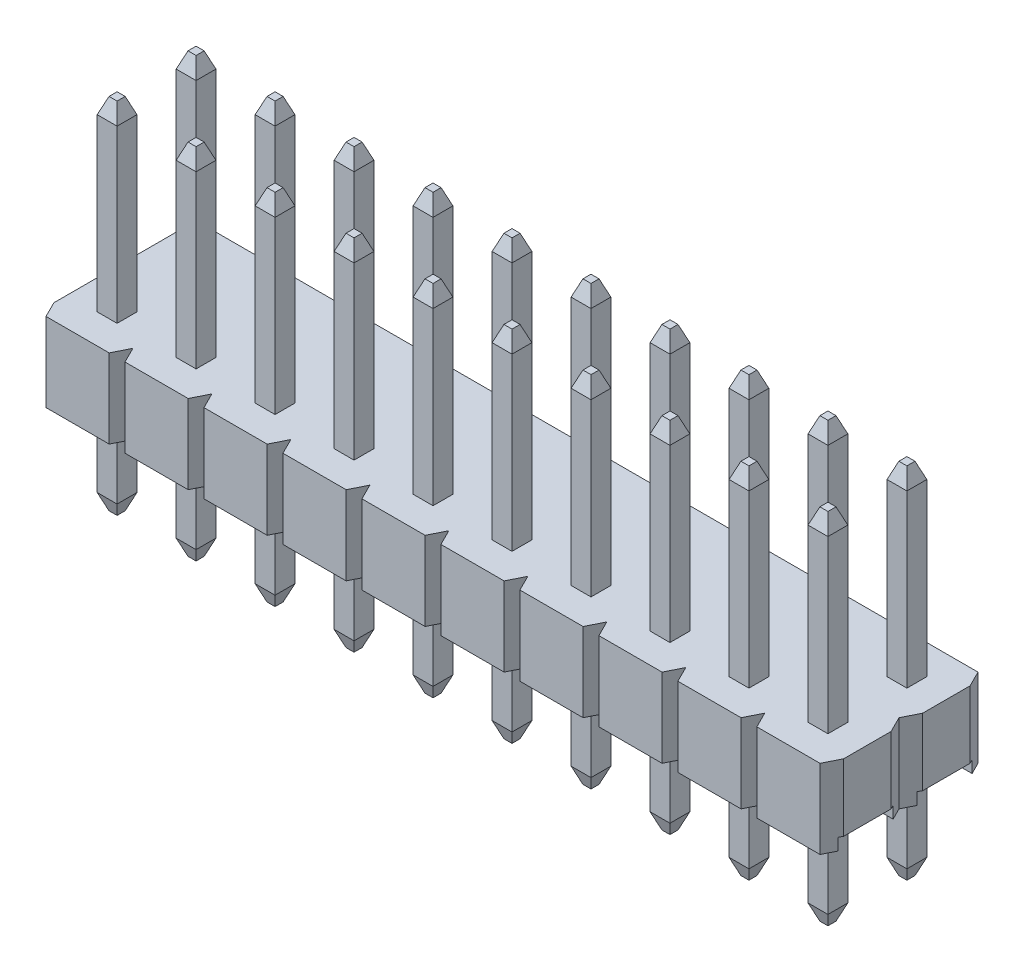
from build123d import *
from OCP.BRepFilletAPI import BRepFilletAPI_MakeChamfer

# Parameters (mm, degrees)
SKETCH1_W                     = 2.54
SKETCH1_H                     = 2.54
MAIN_BODY_DEPTH               = 2.54
SKETCH3_W                     = 1.778
SKETCH3_H                     = 0.381
CUT_EXTRUDE1_DEPTH            = 5.399409051
CUT_EXTRUDE2_DEPTH            = 5.399409051
BODY_PATTERN_COUNT            = 10
BODY_PATTERN_PITCH            = 2.54
PIN_START                     = -5.54
SKETCH2_W                     = 0.64
SKETCH2_H                     = 0.64
PIN_DEPTH                     = 11.54
CHAMFER1_SIZE                 = 0.508
CHAMFER1_SIZE2                = 0.1905
CHAMFER2_SIZE                 = 0.1905
CHAMFER2_SIZE2                = 0.508
PIN_PATTERN_COUNT             = 10
PIN_PATTERN_PITCH             = 2.54
CHAMFER1_OF_PIN_PATTERN_SIZE  = 0.508
CHAMFER1_OF_PIN_PATTERN_SIZE2 = 0.1905
CHAMFER2_OF_PIN_PATTERN_SIZE2 = 0.1905
CHAMFER2_OF_PIN_PATTERN_SIZE  = 0.508
ROW_START                     = 0.381
ROW_PATTERN_DEPTH             = 2.159
ROW_START_2                   = -2.492
ROW_PATTERN_2_OUTLINE_W       = 0.64
ROW_PATTERN_2_OUTLINE_H       = 0.64
ROW_PATTERN_2_DEPTH           = 10.524
ROW_PATTERN_3_DEPTH           = 0.381


with BuildPart() as part:
    # Sketch1 → Main Body (new body)
    with BuildSketch(Plane(origin=(0, 0, 0), x_dir=(1, 0, 0), z_dir=(0, 1, 0))):
        with Locations((1.27, 1.27)):
            Rectangle(SKETCH1_W, SKETCH1_H)
    main_body = extrude(amount=MAIN_BODY_DEPTH)

    # Sketch3 → Cut-Extrude1 (cut, through all)
    with BuildSketch(Plane.ZY):
        with Locations((-1.27, 0.1905)):
            Rectangle(SKETCH3_W, SKETCH3_H)
    cut_extrude1 = extrude(amount=-CUT_EXTRUDE1_DEPTH, mode=Mode.SUBTRACT)

    # Sketch4 → Cut-Extrude2 (cut, through all)
    with BuildSketch(Plane(origin=(0, 2.54, 0), x_dir=(1, 0, 0), z_dir=(0, 1, 0))):
        Polygon((0.254, 2.54), (0, 2.54), (0, 2.032), align=None)
        Polygon((2.54, 2.54), (2.286, 2.54), (2.54, 2.032), align=None)
        Polygon((0.254, 0), (0, 0.508), (0, 0), align=None)
        Polygon((2.54, 0), (2.286, 0), (2.54, 0.508), align=None)
    cut_extrude2 = extrude(amount=-CUT_EXTRUDE2_DEPTH, mode=Mode.SUBTRACT)

    # Body Pattern: Main Body, Cut-Extrude1, Cut-Extrude2 ×10
    with Locations(*[(-i * BODY_PATTERN_PITCH, 0, 0) for i in range(1, BODY_PATTERN_COUNT)]):
        add(main_body)
        add(cut_extrude1, mode=Mode.SUBTRACT)
        add(cut_extrude2, mode=Mode.SUBTRACT)

    # Sketch2 → Pin (add)
    with BuildSketch(Plane(origin=(0, 2.54, 0), x_dir=(1, 0, 0), z_dir=(0, 1, 0)).offset(PIN_START)):
        with Locations((1.27, 1.27)):
            Rectangle(SKETCH2_W, SKETCH2_H)
    pin = extrude(amount=PIN_DEPTH)

    # Chamfer1: one chamfer whose edges measure the first distance from different faces: ONE call of the kernel's chamfer builder (chamfer() names one face for all edges)
    chamfer1_edges_1 = [part.edges().sort_by_distance(p)[0] for p in [
        (0.95, 8.54, -1.27),
    ]]
    chamfer1_side_1 = [part.faces().sort_by_distance(p)[0] for p in [
        (0.95, 5.54, -1.27),
    ]]
    chamfer1_edges_2 = [part.edges().sort_by_distance(p)[0] for p in [
        (1.27, 8.54, -0.95),
    ]]
    chamfer1_side_2 = [part.faces().sort_by_distance(p)[0] for p in [
        (1.27, 5.54, -0.95),
    ]]
    chamfer1_edges_3 = [part.edges().sort_by_distance(p)[0] for p in [
        (1.59, 8.54, -1.27),
    ]]
    chamfer1_side_3 = [part.faces().sort_by_distance(p)[0] for p in [
        (1.59, 5.54, -1.27),
    ]]
    chamfer1_edges_4 = [part.edges().sort_by_distance(p)[0] for p in [
        (1.27, 8.54, -1.59),
    ]]
    chamfer1_side_4 = [part.faces().sort_by_distance(p)[0] for p in [
        (1.27, 5.54, -1.59),
    ]]
    chamfer1 = BRepFilletAPI_MakeChamfer(part.part.solid().wrapped)
    for e in chamfer1_edges_1:
        chamfer1.Add(CHAMFER1_SIZE, CHAMFER1_SIZE2, e.wrapped, chamfer1_side_1[0].wrapped)  # the first distance lies on this face
    for e in chamfer1_edges_2:
        chamfer1.Add(CHAMFER1_SIZE, CHAMFER1_SIZE2, e.wrapped, chamfer1_side_2[0].wrapped)  # the first distance lies on this face
    for e in chamfer1_edges_3:
        chamfer1.Add(CHAMFER1_SIZE, CHAMFER1_SIZE2, e.wrapped, chamfer1_side_3[0].wrapped)  # the first distance lies on this face
    for e in chamfer1_edges_4:
        chamfer1.Add(CHAMFER1_SIZE, CHAMFER1_SIZE2, e.wrapped, chamfer1_side_4[0].wrapped)  # the first distance lies on this face
    add(Compound.cast(chamfer1.Shape()), mode=Mode.REPLACE)

    # Chamfer2
    chamfer2_edges = [part.edges().sort_by_distance(p)[0] for p in [
        (1.27, -3, -0.95),
        (1.59, -3, -1.27),
        (1.27, -3, -1.59),
        (0.95, -3, -1.27),
    ]]
    chamfer2_side = [part.faces().sort_by_distance(p)[0] for p in [
        (1.27, -3, -1.27),
    ]]
    chamfer(chamfer2_edges, length=CHAMFER2_SIZE, length2=CHAMFER2_SIZE2, reference=chamfer2_side[0])

    # Pin Pattern: Pin ×10
    with Locations(*[(-i * PIN_PATTERN_PITCH, 0, 0) for i in range(1, PIN_PATTERN_COUNT)]):
        add(pin)

    # Chamfer1 of Pin Pattern: one chamfer whose edges measure the first distance from different faces: ONE call of the kernel's chamfer builder (chamfer() names one face for all edges)
    chamfer1_of_pin_pattern_edges_1 = [part.edges().sort_by_distance(p)[0] for p in [
        (-1.59, 8.54, -1.27),
    ]]
    chamfer1_of_pin_pattern_side_1 = [part.faces().sort_by_distance(p)[0] for p in [
        (-1.59, 5.54, -1.27),
    ]]
    chamfer1_of_pin_pattern_edges_2 = [part.edges().sort_by_distance(p)[0] for p in [
        (-1.27, 8.54, -0.95),
    ]]
    chamfer1_of_pin_pattern_side_2 = [part.faces().sort_by_distance(p)[0] for p in [
        (-1.27, 5.54, -0.95),
    ]]
    chamfer1_of_pin_pattern_edges_3 = [part.edges().sort_by_distance(p)[0] for p in [
        (-0.95, 8.54, -1.27),
    ]]
    chamfer1_of_pin_pattern_side_3 = [part.faces().sort_by_distance(p)[0] for p in [
        (-0.95, 5.54, -1.27),
    ]]
    chamfer1_of_pin_pattern_edges_4 = [part.edges().sort_by_distance(p)[0] for p in [
        (-1.27, 8.54, -1.59),
    ]]
    chamfer1_of_pin_pattern_side_4 = [part.faces().sort_by_distance(p)[0] for p in [
        (-1.27, 5.54, -1.59),
    ]]
    chamfer1_of_pin_pattern_edges_5 = [part.edges().sort_by_distance(p)[0] for p in [
        (-4.13, 8.54, -1.27),
    ]]
    chamfer1_of_pin_pattern_side_5 = [part.faces().sort_by_distance(p)[0] for p in [
        (-4.13, 5.54, -1.27),
    ]]
    chamfer1_of_pin_pattern_edges_6 = [part.edges().sort_by_distance(p)[0] for p in [
        (-3.81, 8.54, -0.95),
    ]]
    chamfer1_of_pin_pattern_side_6 = [part.faces().sort_by_distance(p)[0] for p in [
        (-3.81, 5.54, -0.95),
    ]]
    chamfer1_of_pin_pattern_edges_7 = [part.edges().sort_by_distance(p)[0] for p in [
        (-3.49, 8.54, -1.27),
    ]]
    chamfer1_of_pin_pattern_side_7 = [part.faces().sort_by_distance(p)[0] for p in [
        (-3.49, 5.54, -1.27),
    ]]
    chamfer1_of_pin_pattern_edges_8 = [part.edges().sort_by_distance(p)[0] for p in [
        (-3.81, 8.54, -1.59),
    ]]
    chamfer1_of_pin_pattern_side_8 = [part.faces().sort_by_distance(p)[0] for p in [
        (-3.81, 5.54, -1.59),
    ]]
    chamfer1_of_pin_pattern_edges_9 = [part.edges().sort_by_distance(p)[0] for p in [
        (-6.67, 8.54, -1.27),
    ]]
    chamfer1_of_pin_pattern_side_9 = [part.faces().sort_by_distance(p)[0] for p in [
        (-6.67, 5.54, -1.27),
    ]]
    chamfer1_of_pin_pattern_edges_10 = [part.edges().sort_by_distance(p)[0] for p in [
        (-6.35, 8.54, -0.95),
    ]]
    chamfer1_of_pin_pattern_side_10 = [part.faces().sort_by_distance(p)[0] for p in [
        (-6.35, 5.54, -0.95),
    ]]
    chamfer1_of_pin_pattern_edges_11 = [part.edges().sort_by_distance(p)[0] for p in [
        (-6.03, 8.54, -1.27),
    ]]
    chamfer1_of_pin_pattern_side_11 = [part.faces().sort_by_distance(p)[0] for p in [
        (-6.03, 5.54, -1.27),
    ]]
    chamfer1_of_pin_pattern_edges_12 = [part.edges().sort_by_distance(p)[0] for p in [
        (-6.35, 8.54, -1.59),
    ]]
    chamfer1_of_pin_pattern_side_12 = [part.faces().sort_by_distance(p)[0] for p in [
        (-6.35, 5.54, -1.59),
    ]]
    chamfer1_of_pin_pattern_edges_13 = [part.edges().sort_by_distance(p)[0] for p in [
        (-9.21, 8.54, -1.27),
    ]]
    chamfer1_of_pin_pattern_side_13 = [part.faces().sort_by_distance(p)[0] for p in [
        (-9.21, 5.54, -1.27),
    ]]
    chamfer1_of_pin_pattern_edges_14 = [part.edges().sort_by_distance(p)[0] for p in [
        (-8.89, 8.54, -0.95),
    ]]
    chamfer1_of_pin_pattern_side_14 = [part.faces().sort_by_distance(p)[0] for p in [
        (-8.89, 5.54, -0.95),
    ]]
    chamfer1_of_pin_pattern_edges_15 = [part.edges().sort_by_distance(p)[0] for p in [
        (-8.57, 8.54, -1.27),
    ]]
    chamfer1_of_pin_pattern_side_15 = [part.faces().sort_by_distance(p)[0] for p in [
        (-8.57, 5.54, -1.27),
    ]]
    chamfer1_of_pin_pattern_edges_16 = [part.edges().sort_by_distance(p)[0] for p in [
        (-8.89, 8.54, -1.59),
    ]]
    chamfer1_of_pin_pattern_side_16 = [part.faces().sort_by_distance(p)[0] for p in [
        (-8.89, 5.54, -1.59),
    ]]
    chamfer1_of_pin_pattern_edges_17 = [part.edges().sort_by_distance(p)[0] for p in [
        (-11.75, 8.54, -1.27),
    ]]
    chamfer1_of_pin_pattern_side_17 = [part.faces().sort_by_distance(p)[0] for p in [
        (-11.75, 5.54, -1.27),
    ]]
    chamfer1_of_pin_pattern_edges_18 = [part.edges().sort_by_distance(p)[0] for p in [
        (-11.43, 8.54, -0.95),
    ]]
    chamfer1_of_pin_pattern_side_18 = [part.faces().sort_by_distance(p)[0] for p in [
        (-11.43, 5.54, -0.95),
    ]]
    chamfer1_of_pin_pattern_edges_19 = [part.edges().sort_by_distance(p)[0] for p in [
        (-11.11, 8.54, -1.27),
    ]]
    chamfer1_of_pin_pattern_side_19 = [part.faces().sort_by_distance(p)[0] for p in [
        (-11.11, 5.54, -1.27),
    ]]
    chamfer1_of_pin_pattern_edges_20 = [part.edges().sort_by_distance(p)[0] for p in [
        (-11.43, 8.54, -1.59),
    ]]
    chamfer1_of_pin_pattern_side_20 = [part.faces().sort_by_distance(p)[0] for p in [
        (-11.43, 5.54, -1.59),
    ]]
    chamfer1_of_pin_pattern_edges_21 = [part.edges().sort_by_distance(p)[0] for p in [
        (-14.29, 8.54, -1.27),
    ]]
    chamfer1_of_pin_pattern_side_21 = [part.faces().sort_by_distance(p)[0] for p in [
        (-14.29, 5.54, -1.27),
    ]]
    chamfer1_of_pin_pattern_edges_22 = [part.edges().sort_by_distance(p)[0] for p in [
        (-13.97, 8.54, -0.95),
    ]]
    chamfer1_of_pin_pattern_side_22 = [part.faces().sort_by_distance(p)[0] for p in [
        (-13.97, 5.54, -0.95),
    ]]
    chamfer1_of_pin_pattern_edges_23 = [part.edges().sort_by_distance(p)[0] for p in [
        (-13.65, 8.54, -1.27),
    ]]
    chamfer1_of_pin_pattern_side_23 = [part.faces().sort_by_distance(p)[0] for p in [
        (-13.65, 5.54, -1.27),
    ]]
    chamfer1_of_pin_pattern_edges_24 = [part.edges().sort_by_distance(p)[0] for p in [
        (-13.97, 8.54, -1.59),
    ]]
    chamfer1_of_pin_pattern_side_24 = [part.faces().sort_by_distance(p)[0] for p in [
        (-13.97, 5.54, -1.59),
    ]]
    chamfer1_of_pin_pattern_edges_25 = [part.edges().sort_by_distance(p)[0] for p in [
        (-16.83, 8.54, -1.27),
    ]]
    chamfer1_of_pin_pattern_side_25 = [part.faces().sort_by_distance(p)[0] for p in [
        (-16.83, 5.54, -1.27),
    ]]
    chamfer1_of_pin_pattern_edges_26 = [part.edges().sort_by_distance(p)[0] for p in [
        (-16.51, 8.54, -0.95),
    ]]
    chamfer1_of_pin_pattern_side_26 = [part.faces().sort_by_distance(p)[0] for p in [
        (-16.51, 5.54, -0.95),
    ]]
    chamfer1_of_pin_pattern_edges_27 = [part.edges().sort_by_distance(p)[0] for p in [
        (-16.19, 8.54, -1.27),
    ]]
    chamfer1_of_pin_pattern_side_27 = [part.faces().sort_by_distance(p)[0] for p in [
        (-16.19, 5.54, -1.27),
    ]]
    chamfer1_of_pin_pattern_edges_28 = [part.edges().sort_by_distance(p)[0] for p in [
        (-16.51, 8.54, -1.59),
    ]]
    chamfer1_of_pin_pattern_side_28 = [part.faces().sort_by_distance(p)[0] for p in [
        (-16.51, 5.54, -1.59),
    ]]
    chamfer1_of_pin_pattern_edges_29 = [part.edges().sort_by_distance(p)[0] for p in [
        (-19.37, 8.54, -1.27),
    ]]
    chamfer1_of_pin_pattern_side_29 = [part.faces().sort_by_distance(p)[0] for p in [
        (-19.37, 5.54, -1.27),
    ]]
    chamfer1_of_pin_pattern_edges_30 = [part.edges().sort_by_distance(p)[0] for p in [
        (-19.05, 8.54, -0.95),
    ]]
    chamfer1_of_pin_pattern_side_30 = [part.faces().sort_by_distance(p)[0] for p in [
        (-19.05, 5.54, -0.95),
    ]]
    chamfer1_of_pin_pattern_edges_31 = [part.edges().sort_by_distance(p)[0] for p in [
        (-18.73, 8.54, -1.27),
    ]]
    chamfer1_of_pin_pattern_side_31 = [part.faces().sort_by_distance(p)[0] for p in [
        (-18.73, 5.54, -1.27),
    ]]
    chamfer1_of_pin_pattern_edges_32 = [part.edges().sort_by_distance(p)[0] for p in [
        (-19.05, 8.54, -1.59),
    ]]
    chamfer1_of_pin_pattern_side_32 = [part.faces().sort_by_distance(p)[0] for p in [
        (-19.05, 5.54, -1.59),
    ]]
    chamfer1_of_pin_pattern_edges_33 = [part.edges().sort_by_distance(p)[0] for p in [
        (-21.91, 8.54, -1.27),
    ]]
    chamfer1_of_pin_pattern_side_33 = [part.faces().sort_by_distance(p)[0] for p in [
        (-21.91, 5.54, -1.27),
    ]]
    chamfer1_of_pin_pattern_edges_34 = [part.edges().sort_by_distance(p)[0] for p in [
        (-21.59, 8.54, -0.95),
    ]]
    chamfer1_of_pin_pattern_side_34 = [part.faces().sort_by_distance(p)[0] for p in [
        (-21.59, 5.54, -0.95),
    ]]
    chamfer1_of_pin_pattern_edges_35 = [part.edges().sort_by_distance(p)[0] for p in [
        (-21.27, 8.54, -1.27),
    ]]
    chamfer1_of_pin_pattern_side_35 = [part.faces().sort_by_distance(p)[0] for p in [
        (-21.27, 5.54, -1.27),
    ]]
    chamfer1_of_pin_pattern_edges_36 = [part.edges().sort_by_distance(p)[0] for p in [
        (-21.59, 8.54, -1.59),
    ]]
    chamfer1_of_pin_pattern_side_36 = [part.faces().sort_by_distance(p)[0] for p in [
        (-21.59, 5.54, -1.59),
    ]]
    chamfer1_of_pin_pattern = BRepFilletAPI_MakeChamfer(part.part.solid().wrapped)
    for e in chamfer1_of_pin_pattern_edges_1:
        chamfer1_of_pin_pattern.Add(CHAMFER1_OF_PIN_PATTERN_SIZE, CHAMFER1_OF_PIN_PATTERN_SIZE2, e.wrapped, chamfer1_of_pin_pattern_side_1[0].wrapped)  # the first distance lies on this face
    for e in chamfer1_of_pin_pattern_edges_2:
        chamfer1_of_pin_pattern.Add(CHAMFER1_OF_PIN_PATTERN_SIZE, CHAMFER1_OF_PIN_PATTERN_SIZE2, e.wrapped, chamfer1_of_pin_pattern_side_2[0].wrapped)  # the first distance lies on this face
    for e in chamfer1_of_pin_pattern_edges_3:
        chamfer1_of_pin_pattern.Add(CHAMFER1_OF_PIN_PATTERN_SIZE, CHAMFER1_OF_PIN_PATTERN_SIZE2, e.wrapped, chamfer1_of_pin_pattern_side_3[0].wrapped)  # the first distance lies on this face
    for e in chamfer1_of_pin_pattern_edges_4:
        chamfer1_of_pin_pattern.Add(CHAMFER1_OF_PIN_PATTERN_SIZE, CHAMFER1_OF_PIN_PATTERN_SIZE2, e.wrapped, chamfer1_of_pin_pattern_side_4[0].wrapped)  # the first distance lies on this face
    for e in chamfer1_of_pin_pattern_edges_5:
        chamfer1_of_pin_pattern.Add(CHAMFER1_OF_PIN_PATTERN_SIZE, CHAMFER1_OF_PIN_PATTERN_SIZE2, e.wrapped, chamfer1_of_pin_pattern_side_5[0].wrapped)  # the first distance lies on this face
    for e in chamfer1_of_pin_pattern_edges_6:
        chamfer1_of_pin_pattern.Add(CHAMFER1_OF_PIN_PATTERN_SIZE, CHAMFER1_OF_PIN_PATTERN_SIZE2, e.wrapped, chamfer1_of_pin_pattern_side_6[0].wrapped)  # the first distance lies on this face
    for e in chamfer1_of_pin_pattern_edges_7:
        chamfer1_of_pin_pattern.Add(CHAMFER1_OF_PIN_PATTERN_SIZE, CHAMFER1_OF_PIN_PATTERN_SIZE2, e.wrapped, chamfer1_of_pin_pattern_side_7[0].wrapped)  # the first distance lies on this face
    for e in chamfer1_of_pin_pattern_edges_8:
        chamfer1_of_pin_pattern.Add(CHAMFER1_OF_PIN_PATTERN_SIZE, CHAMFER1_OF_PIN_PATTERN_SIZE2, e.wrapped, chamfer1_of_pin_pattern_side_8[0].wrapped)  # the first distance lies on this face
    for e in chamfer1_of_pin_pattern_edges_9:
        chamfer1_of_pin_pattern.Add(CHAMFER1_OF_PIN_PATTERN_SIZE, CHAMFER1_OF_PIN_PATTERN_SIZE2, e.wrapped, chamfer1_of_pin_pattern_side_9[0].wrapped)  # the first distance lies on this face
    for e in chamfer1_of_pin_pattern_edges_10:
        chamfer1_of_pin_pattern.Add(CHAMFER1_OF_PIN_PATTERN_SIZE, CHAMFER1_OF_PIN_PATTERN_SIZE2, e.wrapped, chamfer1_of_pin_pattern_side_10[0].wrapped)  # the first distance lies on this face
    for e in chamfer1_of_pin_pattern_edges_11:
        chamfer1_of_pin_pattern.Add(CHAMFER1_OF_PIN_PATTERN_SIZE, CHAMFER1_OF_PIN_PATTERN_SIZE2, e.wrapped, chamfer1_of_pin_pattern_side_11[0].wrapped)  # the first distance lies on this face
    for e in chamfer1_of_pin_pattern_edges_12:
        chamfer1_of_pin_pattern.Add(CHAMFER1_OF_PIN_PATTERN_SIZE, CHAMFER1_OF_PIN_PATTERN_SIZE2, e.wrapped, chamfer1_of_pin_pattern_side_12[0].wrapped)  # the first distance lies on this face
    for e in chamfer1_of_pin_pattern_edges_13:
        chamfer1_of_pin_pattern.Add(CHAMFER1_OF_PIN_PATTERN_SIZE, CHAMFER1_OF_PIN_PATTERN_SIZE2, e.wrapped, chamfer1_of_pin_pattern_side_13[0].wrapped)  # the first distance lies on this face
    for e in chamfer1_of_pin_pattern_edges_14:
        chamfer1_of_pin_pattern.Add(CHAMFER1_OF_PIN_PATTERN_SIZE, CHAMFER1_OF_PIN_PATTERN_SIZE2, e.wrapped, chamfer1_of_pin_pattern_side_14[0].wrapped)  # the first distance lies on this face
    for e in chamfer1_of_pin_pattern_edges_15:
        chamfer1_of_pin_pattern.Add(CHAMFER1_OF_PIN_PATTERN_SIZE, CHAMFER1_OF_PIN_PATTERN_SIZE2, e.wrapped, chamfer1_of_pin_pattern_side_15[0].wrapped)  # the first distance lies on this face
    for e in chamfer1_of_pin_pattern_edges_16:
        chamfer1_of_pin_pattern.Add(CHAMFER1_OF_PIN_PATTERN_SIZE, CHAMFER1_OF_PIN_PATTERN_SIZE2, e.wrapped, chamfer1_of_pin_pattern_side_16[0].wrapped)  # the first distance lies on this face
    for e in chamfer1_of_pin_pattern_edges_17:
        chamfer1_of_pin_pattern.Add(CHAMFER1_OF_PIN_PATTERN_SIZE, CHAMFER1_OF_PIN_PATTERN_SIZE2, e.wrapped, chamfer1_of_pin_pattern_side_17[0].wrapped)  # the first distance lies on this face
    for e in chamfer1_of_pin_pattern_edges_18:
        chamfer1_of_pin_pattern.Add(CHAMFER1_OF_PIN_PATTERN_SIZE, CHAMFER1_OF_PIN_PATTERN_SIZE2, e.wrapped, chamfer1_of_pin_pattern_side_18[0].wrapped)  # the first distance lies on this face
    for e in chamfer1_of_pin_pattern_edges_19:
        chamfer1_of_pin_pattern.Add(CHAMFER1_OF_PIN_PATTERN_SIZE, CHAMFER1_OF_PIN_PATTERN_SIZE2, e.wrapped, chamfer1_of_pin_pattern_side_19[0].wrapped)  # the first distance lies on this face
    for e in chamfer1_of_pin_pattern_edges_20:
        chamfer1_of_pin_pattern.Add(CHAMFER1_OF_PIN_PATTERN_SIZE, CHAMFER1_OF_PIN_PATTERN_SIZE2, e.wrapped, chamfer1_of_pin_pattern_side_20[0].wrapped)  # the first distance lies on this face
    for e in chamfer1_of_pin_pattern_edges_21:
        chamfer1_of_pin_pattern.Add(CHAMFER1_OF_PIN_PATTERN_SIZE, CHAMFER1_OF_PIN_PATTERN_SIZE2, e.wrapped, chamfer1_of_pin_pattern_side_21[0].wrapped)  # the first distance lies on this face
    for e in chamfer1_of_pin_pattern_edges_22:
        chamfer1_of_pin_pattern.Add(CHAMFER1_OF_PIN_PATTERN_SIZE, CHAMFER1_OF_PIN_PATTERN_SIZE2, e.wrapped, chamfer1_of_pin_pattern_side_22[0].wrapped)  # the first distance lies on this face
    for e in chamfer1_of_pin_pattern_edges_23:
        chamfer1_of_pin_pattern.Add(CHAMFER1_OF_PIN_PATTERN_SIZE, CHAMFER1_OF_PIN_PATTERN_SIZE2, e.wrapped, chamfer1_of_pin_pattern_side_23[0].wrapped)  # the first distance lies on this face
    for e in chamfer1_of_pin_pattern_edges_24:
        chamfer1_of_pin_pattern.Add(CHAMFER1_OF_PIN_PATTERN_SIZE, CHAMFER1_OF_PIN_PATTERN_SIZE2, e.wrapped, chamfer1_of_pin_pattern_side_24[0].wrapped)  # the first distance lies on this face
    for e in chamfer1_of_pin_pattern_edges_25:
        chamfer1_of_pin_pattern.Add(CHAMFER1_OF_PIN_PATTERN_SIZE, CHAMFER1_OF_PIN_PATTERN_SIZE2, e.wrapped, chamfer1_of_pin_pattern_side_25[0].wrapped)  # the first distance lies on this face
    for e in chamfer1_of_pin_pattern_edges_26:
        chamfer1_of_pin_pattern.Add(CHAMFER1_OF_PIN_PATTERN_SIZE, CHAMFER1_OF_PIN_PATTERN_SIZE2, e.wrapped, chamfer1_of_pin_pattern_side_26[0].wrapped)  # the first distance lies on this face
    for e in chamfer1_of_pin_pattern_edges_27:
        chamfer1_of_pin_pattern.Add(CHAMFER1_OF_PIN_PATTERN_SIZE, CHAMFER1_OF_PIN_PATTERN_SIZE2, e.wrapped, chamfer1_of_pin_pattern_side_27[0].wrapped)  # the first distance lies on this face
    for e in chamfer1_of_pin_pattern_edges_28:
        chamfer1_of_pin_pattern.Add(CHAMFER1_OF_PIN_PATTERN_SIZE, CHAMFER1_OF_PIN_PATTERN_SIZE2, e.wrapped, chamfer1_of_pin_pattern_side_28[0].wrapped)  # the first distance lies on this face
    for e in chamfer1_of_pin_pattern_edges_29:
        chamfer1_of_pin_pattern.Add(CHAMFER1_OF_PIN_PATTERN_SIZE, CHAMFER1_OF_PIN_PATTERN_SIZE2, e.wrapped, chamfer1_of_pin_pattern_side_29[0].wrapped)  # the first distance lies on this face
    for e in chamfer1_of_pin_pattern_edges_30:
        chamfer1_of_pin_pattern.Add(CHAMFER1_OF_PIN_PATTERN_SIZE, CHAMFER1_OF_PIN_PATTERN_SIZE2, e.wrapped, chamfer1_of_pin_pattern_side_30[0].wrapped)  # the first distance lies on this face
    for e in chamfer1_of_pin_pattern_edges_31:
        chamfer1_of_pin_pattern.Add(CHAMFER1_OF_PIN_PATTERN_SIZE, CHAMFER1_OF_PIN_PATTERN_SIZE2, e.wrapped, chamfer1_of_pin_pattern_side_31[0].wrapped)  # the first distance lies on this face
    for e in chamfer1_of_pin_pattern_edges_32:
        chamfer1_of_pin_pattern.Add(CHAMFER1_OF_PIN_PATTERN_SIZE, CHAMFER1_OF_PIN_PATTERN_SIZE2, e.wrapped, chamfer1_of_pin_pattern_side_32[0].wrapped)  # the first distance lies on this face
    for e in chamfer1_of_pin_pattern_edges_33:
        chamfer1_of_pin_pattern.Add(CHAMFER1_OF_PIN_PATTERN_SIZE, CHAMFER1_OF_PIN_PATTERN_SIZE2, e.wrapped, chamfer1_of_pin_pattern_side_33[0].wrapped)  # the first distance lies on this face
    for e in chamfer1_of_pin_pattern_edges_34:
        chamfer1_of_pin_pattern.Add(CHAMFER1_OF_PIN_PATTERN_SIZE, CHAMFER1_OF_PIN_PATTERN_SIZE2, e.wrapped, chamfer1_of_pin_pattern_side_34[0].wrapped)  # the first distance lies on this face
    for e in chamfer1_of_pin_pattern_edges_35:
        chamfer1_of_pin_pattern.Add(CHAMFER1_OF_PIN_PATTERN_SIZE, CHAMFER1_OF_PIN_PATTERN_SIZE2, e.wrapped, chamfer1_of_pin_pattern_side_35[0].wrapped)  # the first distance lies on this face
    for e in chamfer1_of_pin_pattern_edges_36:
        chamfer1_of_pin_pattern.Add(CHAMFER1_OF_PIN_PATTERN_SIZE, CHAMFER1_OF_PIN_PATTERN_SIZE2, e.wrapped, chamfer1_of_pin_pattern_side_36[0].wrapped)  # the first distance lies on this face
    add(Compound.cast(chamfer1_of_pin_pattern.Shape()), mode=Mode.REPLACE)

    # Chamfer2 of Pin Pattern
    chamfer2_of_pin_pattern_edges = [part.edges().sort_by_distance(p)[0] for p in [
        (-1.27, -3, -0.95),
        (-0.95, -3, -1.27),
        (-1.27, -3, -1.59),
        (-1.59, -3, -1.27),
        (-3.81, -3, -0.95),
        (-3.49, -3, -1.27),
        (-3.81, -3, -1.59),
        (-4.13, -3, -1.27),
        (-6.35, -3, -0.95),
        (-6.03, -3, -1.27),
        (-6.35, -3, -1.59),
        (-6.67, -3, -1.27),
        (-8.89, -3, -0.95),
        (-8.57, -3, -1.27),
        (-8.89, -3, -1.59),
        (-9.21, -3, -1.27),
        (-11.43, -3, -0.95),
        (-11.11, -3, -1.27),
        (-11.43, -3, -1.59),
        (-11.75, -3, -1.27),
        (-13.97, -3, -0.95),
        (-13.65, -3, -1.27),
        (-13.97, -3, -1.59),
        (-14.29, -3, -1.27),
        (-16.51, -3, -0.95),
        (-16.19, -3, -1.27),
        (-16.51, -3, -1.59),
        (-16.83, -3, -1.27),
        (-19.05, -3, -0.95),
        (-18.73, -3, -1.27),
        (-19.05, -3, -1.59),
        (-19.37, -3, -1.27),
        (-21.59, -3, -0.95),
        (-21.27, -3, -1.27),
        (-21.59, -3, -1.59),
        (-21.91, -3, -1.27),
    ]]
    chamfer(chamfer2_of_pin_pattern_edges, length=CHAMFER2_OF_PIN_PATTERN_SIZE, length2=CHAMFER2_OF_PIN_PATTERN_SIZE2)

    # Row Pattern: read off the stored shape, not the designer's step
    # Row Pattern outline → Row Pattern (add)
    with BuildSketch(Plane(origin=(0, 0, 0), x_dir=(1, 0, 0), z_dir=(0, 1, 0)).offset(ROW_START)):
        Polygon((-22.86, 3.048), (-22.606, 2.54), (-20.574, 2.54), (-20.32, 3.048), (-20.066, 2.54), (-18.034, 2.54), (-17.78, 3.048), (-17.526, 2.54), (-15.494, 2.54), (-15.24, 3.048), (-14.986, 2.54), (-12.954, 2.54), (-12.7, 3.048), (-12.446, 2.54), (-10.414, 2.54), (-10.16, 3.048), (-9.906, 2.54), (-7.874, 2.54), (-7.62, 3.048), (-7.366, 2.54), (-5.334, 2.54), (-5.08, 3.048), (-4.826, 2.54), (-2.794, 2.54), (-2.54, 3.048), (-2.286, 2.54), (-0.254, 2.54), (0, 3.048), (0.254, 2.54), (2.286, 2.54), (2.54, 3.048), (2.54, 4.572), (2.286, 5.08), (0.254, 5.08), (0, 4.572), (-0.254, 5.08), (-2.286, 5.08), (-2.54, 4.572), (-2.794, 5.08), (-4.826, 5.08), (-5.08, 4.572), (-5.334, 5.08), (-7.366, 5.08), (-7.62, 4.572), (-7.874, 5.08), (-9.906, 5.08), (-10.16, 4.572), (-10.414, 5.08), (-12.446, 5.08), (-12.7, 4.572), (-12.954, 5.08), (-14.986, 5.08), (-15.24, 4.572), (-15.494, 5.08), (-17.526, 5.08), (-17.78, 4.572), (-18.034, 5.08), (-20.066, 5.08), (-20.32, 4.572), (-20.574, 5.08), (-22.606, 5.08), (-22.86, 4.572), align=None)
    extrude(amount=ROW_PATTERN_DEPTH)

    # Row Pattern 2 outline → Row Pattern 2 (add)
    with BuildSketch(Plane(origin=(0, 0, 0), x_dir=(1, 0, 0), z_dir=(0, 1, 0)).offset(ROW_START_2)):
        with Locations((1.27, 3.81)):
            Rectangle(ROW_PATTERN_2_OUTLINE_W, ROW_PATTERN_2_OUTLINE_H)
        with Locations((-1.27, 3.81)):
            Rectangle(ROW_PATTERN_2_OUTLINE_W, ROW_PATTERN_2_OUTLINE_H)
        with Locations((-3.81, 3.81)):
            Rectangle(ROW_PATTERN_2_OUTLINE_W, ROW_PATTERN_2_OUTLINE_H)
        with Locations((-6.35, 3.81)):
            Rectangle(ROW_PATTERN_2_OUTLINE_W, ROW_PATTERN_2_OUTLINE_H)
        with Locations((-8.89, 3.81)):
            Rectangle(ROW_PATTERN_2_OUTLINE_W, ROW_PATTERN_2_OUTLINE_H)
        with Locations((-11.43, 3.81)):
            Rectangle(ROW_PATTERN_2_OUTLINE_W, ROW_PATTERN_2_OUTLINE_H)
        with Locations((-13.97, 3.81)):
            Rectangle(ROW_PATTERN_2_OUTLINE_W, ROW_PATTERN_2_OUTLINE_H)
        with Locations((-16.51, 3.81)):
            Rectangle(ROW_PATTERN_2_OUTLINE_W, ROW_PATTERN_2_OUTLINE_H)
        with Locations((-19.05, 3.81)):
            Rectangle(ROW_PATTERN_2_OUTLINE_W, ROW_PATTERN_2_OUTLINE_H)
        with Locations((-21.59, 3.81)):
            Rectangle(ROW_PATTERN_2_OUTLINE_W, ROW_PATTERN_2_OUTLINE_H)
    extrude(amount=ROW_PATTERN_2_DEPTH)

    # Row Pattern 3 outline → Row Pattern 3 (add)
    with BuildSketch(Plane(origin=(0, 0, 0), x_dir=(1, 0, 0), z_dir=(0, 1, 0))):
        Polygon((-20.3835, 2.921), (-22.7965, 2.921), (-22.606, 2.54), (-20.574, 2.54), align=None)
        Polygon((-17.8435, 2.921), (-20.2565, 2.921), (-20.066, 2.54), (-18.034, 2.54), align=None)
        Polygon((-22.606, 5.08), (-22.7965, 4.699), (-20.3835, 4.699), (-20.574, 5.08), align=None)
        Polygon((-15.3035, 2.921), (-17.7165, 2.921), (-17.526, 2.54), (-15.494, 2.54), align=None)
        Polygon((-20.066, 5.08), (-20.2565, 4.699), (-17.8435, 4.699), (-18.034, 5.08), align=None)
        Polygon((-12.7635, 2.921), (-15.1765, 2.921), (-14.986, 2.54), (-12.954, 2.54), align=None)
        Polygon((-17.526, 5.08), (-17.7165, 4.699), (-15.3035, 4.699), (-15.494, 5.08), align=None)
        Polygon((-10.2235, 2.921), (-12.6365, 2.921), (-12.446, 2.54), (-10.414, 2.54), align=None)
        Polygon((-14.986, 5.08), (-15.1765, 4.699), (-12.7635, 4.699), (-12.954, 5.08), align=None)
        Polygon((-7.6835, 2.921), (-10.0965, 2.921), (-9.906, 2.54), (-7.874, 2.54), align=None)
        Polygon((-12.446, 5.08), (-12.6365, 4.699), (-10.2235, 4.699), (-10.414, 5.08), align=None)
        Polygon((-5.1435, 2.921), (-7.5565, 2.921), (-7.366, 2.54), (-5.334, 2.54), align=None)
        Polygon((-9.906, 5.08), (-10.0965, 4.699), (-7.6835, 4.699), (-7.874, 5.08), align=None)
        Polygon((-2.6035, 2.921), (-5.0165, 2.921), (-4.826, 2.54), (-2.794, 2.54), align=None)
        Polygon((-7.366, 5.08), (-7.5565, 4.699), (-5.1435, 4.699), (-5.334, 5.08), align=None)
        Polygon((-0.0635, 2.921), (-2.4765, 2.921), (-2.286, 2.54), (-0.254, 2.54), align=None)
        Polygon((-4.826, 5.08), (-5.0165, 4.699), (-2.6035, 4.699), (-2.794, 5.08), align=None)
        Polygon((2.4765, 2.921), (0.0635, 2.921), (0.254, 2.54), (2.286, 2.54), align=None)
        Polygon((-2.286, 5.08), (-2.4765, 4.699), (-0.0635, 4.699), (-0.254, 5.08), align=None)
        Polygon((0.254, 5.08), (0.0635, 4.699), (2.4765, 4.699), (2.286, 5.08), align=None)
    extrude(amount=ROW_PATTERN_3_DEPTH)

    # Row Pattern 4: loft between two sections, ruled curve by curve
    row_pattern_4_from = [
        Edge.make_line((1.59, -2.492, -3.49), (1.59, -2.492, -4.13)),
        Edge.make_line((0.95, -2.492, -3.49), (0.95, -2.492, -4.13)),
        Edge.make_line((0.95, -2.492, -3.49), (1.59, -2.492, -3.49)),
        Edge.make_line((1.59, -2.492, -4.13), (0.95, -2.492, -4.13)),
    ]
    row_pattern_4_to = [
        Edge.make_line((1.3995, -3, -3.6805), (1.3995, -3, -3.9395)),
        Edge.make_line((1.1405, -3, -3.6805), (1.1405, -3, -3.9395)),
        Edge.make_line((1.1405, -3, -3.6805), (1.3995, -3, -3.6805)),
        Edge.make_line((1.3995, -3, -3.9395), (1.1405, -3, -3.9395)),
    ]
    row_pattern_4 = Solid(Shell([*[Face.make_surface_from_curves(row_pattern_4_from[k], row_pattern_4_to[k]) for k in range(4)], Face(Wire(row_pattern_4_from)), Face(Wire(row_pattern_4_to))]))
    add(row_pattern_4)

    # Row Pattern 5: loft between two sections, ruled curve by curve
    row_pattern_5_from = [
        Edge.make_line((-0.95, -2.492, -3.49), (-0.95, -2.492, -4.13)),
        Edge.make_line((-1.59, -2.492, -3.49), (-1.59, -2.492, -4.13)),
        Edge.make_line((-1.59, -2.492, -3.49), (-0.95, -2.492, -3.49)),
        Edge.make_line((-0.95, -2.492, -4.13), (-1.59, -2.492, -4.13)),
    ]
    row_pattern_5_to = [
        Edge.make_line((-1.1405, -3, -3.6805), (-1.1405, -3, -3.9395)),
        Edge.make_line((-1.3995, -3, -3.6805), (-1.3995, -3, -3.9395)),
        Edge.make_line((-1.3995, -3, -3.6805), (-1.1405, -3, -3.6805)),
        Edge.make_line((-1.1405, -3, -3.9395), (-1.3995, -3, -3.9395)),
    ]
    row_pattern_5 = Solid(Shell([*[Face.make_surface_from_curves(row_pattern_5_from[k], row_pattern_5_to[k]) for k in range(4)], Face(Wire(row_pattern_5_from)), Face(Wire(row_pattern_5_to))]))
    add(row_pattern_5)

    # Row Pattern 6: loft between two sections, ruled curve by curve
    row_pattern_6_from = [
        Edge.make_line((-3.49, -2.492, -3.49), (-3.49, -2.492, -4.13)),
        Edge.make_line((-4.13, -2.492, -3.49), (-4.13, -2.492, -4.13)),
        Edge.make_line((-4.13, -2.492, -3.49), (-3.49, -2.492, -3.49)),
        Edge.make_line((-3.49, -2.492, -4.13), (-4.13, -2.492, -4.13)),
    ]
    row_pattern_6_to = [
        Edge.make_line((-3.6805, -3, -3.6805), (-3.6805, -3, -3.9395)),
        Edge.make_line((-3.9395, -3, -3.6805), (-3.9395, -3, -3.9395)),
        Edge.make_line((-3.9395, -3, -3.6805), (-3.6805, -3, -3.6805)),
        Edge.make_line((-3.6805, -3, -3.9395), (-3.9395, -3, -3.9395)),
    ]
    row_pattern_6 = Solid(Shell([*[Face.make_surface_from_curves(row_pattern_6_from[k], row_pattern_6_to[k]) for k in range(4)], Face(Wire(row_pattern_6_from)), Face(Wire(row_pattern_6_to))]))
    add(row_pattern_6)

    # Row Pattern 7: loft between two sections, ruled curve by curve
    row_pattern_7_from = [
        Edge.make_line((-6.03, -2.492, -3.49), (-6.03, -2.492, -4.13)),
        Edge.make_line((-6.67, -2.492, -3.49), (-6.67, -2.492, -4.13)),
        Edge.make_line((-6.67, -2.492, -3.49), (-6.03, -2.492, -3.49)),
        Edge.make_line((-6.03, -2.492, -4.13), (-6.67, -2.492, -4.13)),
    ]
    row_pattern_7_to = [
        Edge.make_line((-6.2205, -3, -3.6805), (-6.2205, -3, -3.9395)),
        Edge.make_line((-6.4795, -3, -3.6805), (-6.4795, -3, -3.9395)),
        Edge.make_line((-6.4795, -3, -3.6805), (-6.2205, -3, -3.6805)),
        Edge.make_line((-6.2205, -3, -3.9395), (-6.4795, -3, -3.9395)),
    ]
    row_pattern_7 = Solid(Shell([*[Face.make_surface_from_curves(row_pattern_7_from[k], row_pattern_7_to[k]) for k in range(4)], Face(Wire(row_pattern_7_from)), Face(Wire(row_pattern_7_to))]))
    add(row_pattern_7)

    # Row Pattern 8: loft between two sections, ruled curve by curve
    row_pattern_8_from = [
        Edge.make_line((-8.57, -2.492, -3.49), (-8.57, -2.492, -4.13)),
        Edge.make_line((-9.21, -2.492, -3.49), (-9.21, -2.492, -4.13)),
        Edge.make_line((-9.21, -2.492, -3.49), (-8.57, -2.492, -3.49)),
        Edge.make_line((-8.57, -2.492, -4.13), (-9.21, -2.492, -4.13)),
    ]
    row_pattern_8_to = [
        Edge.make_line((-8.7605, -3, -3.6805), (-8.7605, -3, -3.9395)),
        Edge.make_line((-9.0195, -3, -3.6805), (-9.0195, -3, -3.9395)),
        Edge.make_line((-9.0195, -3, -3.6805), (-8.7605, -3, -3.6805)),
        Edge.make_line((-8.7605, -3, -3.9395), (-9.0195, -3, -3.9395)),
    ]
    row_pattern_8 = Solid(Shell([*[Face.make_surface_from_curves(row_pattern_8_from[k], row_pattern_8_to[k]) for k in range(4)], Face(Wire(row_pattern_8_from)), Face(Wire(row_pattern_8_to))]))
    add(row_pattern_8)

    # Row Pattern 9: loft between two sections, ruled curve by curve
    row_pattern_9_from = [
        Edge.make_line((-11.11, -2.492, -3.49), (-11.11, -2.492, -4.13)),
        Edge.make_line((-11.75, -2.492, -3.49), (-11.75, -2.492, -4.13)),
        Edge.make_line((-11.75, -2.492, -3.49), (-11.11, -2.492, -3.49)),
        Edge.make_line((-11.11, -2.492, -4.13), (-11.75, -2.492, -4.13)),
    ]
    row_pattern_9_to = [
        Edge.make_line((-11.3005, -3, -3.6805), (-11.3005, -3, -3.9395)),
        Edge.make_line((-11.5595, -3, -3.6805), (-11.5595, -3, -3.9395)),
        Edge.make_line((-11.5595, -3, -3.6805), (-11.3005, -3, -3.6805)),
        Edge.make_line((-11.3005, -3, -3.9395), (-11.5595, -3, -3.9395)),
    ]
    row_pattern_9 = Solid(Shell([*[Face.make_surface_from_curves(row_pattern_9_from[k], row_pattern_9_to[k]) for k in range(4)], Face(Wire(row_pattern_9_from)), Face(Wire(row_pattern_9_to))]))
    add(row_pattern_9)

    # Row Pattern 10: loft between two sections, ruled curve by curve
    row_pattern_10_from = [
        Edge.make_line((-13.65, -2.492, -3.49), (-13.65, -2.492, -4.13)),
        Edge.make_line((-14.29, -2.492, -3.49), (-14.29, -2.492, -4.13)),
        Edge.make_line((-14.29, -2.492, -3.49), (-13.65, -2.492, -3.49)),
        Edge.make_line((-13.65, -2.492, -4.13), (-14.29, -2.492, -4.13)),
    ]
    row_pattern_10_to = [
        Edge.make_line((-13.8405, -3, -3.6805), (-13.8405, -3, -3.9395)),
        Edge.make_line((-14.0995, -3, -3.6805), (-14.0995, -3, -3.9395)),
        Edge.make_line((-14.0995, -3, -3.6805), (-13.8405, -3, -3.6805)),
        Edge.make_line((-13.8405, -3, -3.9395), (-14.0995, -3, -3.9395)),
    ]
    row_pattern_10 = Solid(Shell([*[Face.make_surface_from_curves(row_pattern_10_from[k], row_pattern_10_to[k]) for k in range(4)], Face(Wire(row_pattern_10_from)), Face(Wire(row_pattern_10_to))]))
    add(row_pattern_10)

    # Row Pattern 11: loft between two sections, ruled curve by curve
    row_pattern_11_from = [
        Edge.make_line((-16.19, -2.492, -3.49), (-16.19, -2.492, -4.13)),
        Edge.make_line((-16.83, -2.492, -3.49), (-16.83, -2.492, -4.13)),
        Edge.make_line((-16.83, -2.492, -3.49), (-16.19, -2.492, -3.49)),
        Edge.make_line((-16.19, -2.492, -4.13), (-16.83, -2.492, -4.13)),
    ]
    row_pattern_11_to = [
        Edge.make_line((-16.3805, -3, -3.6805), (-16.3805, -3, -3.9395)),
        Edge.make_line((-16.6395, -3, -3.6805), (-16.6395, -3, -3.9395)),
        Edge.make_line((-16.6395, -3, -3.6805), (-16.3805, -3, -3.6805)),
        Edge.make_line((-16.3805, -3, -3.9395), (-16.6395, -3, -3.9395)),
    ]
    row_pattern_11 = Solid(Shell([*[Face.make_surface_from_curves(row_pattern_11_from[k], row_pattern_11_to[k]) for k in range(4)], Face(Wire(row_pattern_11_from)), Face(Wire(row_pattern_11_to))]))
    add(row_pattern_11)

    # Row Pattern 12: loft between two sections, ruled curve by curve
    row_pattern_12_from = [
        Edge.make_line((-18.73, -2.492, -3.49), (-18.73, -2.492, -4.13)),
        Edge.make_line((-19.37, -2.492, -3.49), (-19.37, -2.492, -4.13)),
        Edge.make_line((-19.37, -2.492, -3.49), (-18.73, -2.492, -3.49)),
        Edge.make_line((-18.73, -2.492, -4.13), (-19.37, -2.492, -4.13)),
    ]
    row_pattern_12_to = [
        Edge.make_line((-18.9205, -3, -3.6805), (-18.9205, -3, -3.9395)),
        Edge.make_line((-19.1795, -3, -3.6805), (-19.1795, -3, -3.9395)),
        Edge.make_line((-19.1795, -3, -3.6805), (-18.9205, -3, -3.6805)),
        Edge.make_line((-18.9205, -3, -3.9395), (-19.1795, -3, -3.9395)),
    ]
    row_pattern_12 = Solid(Shell([*[Face.make_surface_from_curves(row_pattern_12_from[k], row_pattern_12_to[k]) for k in range(4)], Face(Wire(row_pattern_12_from)), Face(Wire(row_pattern_12_to))]))
    add(row_pattern_12)

    # Row Pattern 13: loft between two sections, ruled curve by curve
    row_pattern_13_from = [
        Edge.make_line((-21.27, -2.492, -3.49), (-21.27, -2.492, -4.13)),
        Edge.make_line((-21.91, -2.492, -3.49), (-21.91, -2.492, -4.13)),
        Edge.make_line((-21.91, -2.492, -3.49), (-21.27, -2.492, -3.49)),
        Edge.make_line((-21.27, -2.492, -4.13), (-21.91, -2.492, -4.13)),
    ]
    row_pattern_13_to = [
        Edge.make_line((-21.4605, -3, -3.6805), (-21.4605, -3, -3.9395)),
        Edge.make_line((-21.7195, -3, -3.6805), (-21.7195, -3, -3.9395)),
        Edge.make_line((-21.7195, -3, -3.6805), (-21.4605, -3, -3.6805)),
        Edge.make_line((-21.4605, -3, -3.9395), (-21.7195, -3, -3.9395)),
    ]
    row_pattern_13 = Solid(Shell([*[Face.make_surface_from_curves(row_pattern_13_from[k], row_pattern_13_to[k]) for k in range(4)], Face(Wire(row_pattern_13_from)), Face(Wire(row_pattern_13_to))]))
    add(row_pattern_13)

    # Row Pattern 14: loft between two sections, ruled curve by curve
    row_pattern_14_from = [
        Edge.make_line((1.3995, 8.54, -3.6805), (1.3995, 8.54, -3.9395)),
        Edge.make_line((1.1405, 8.54, -3.9395), (1.1405, 8.54, -3.6805)),
        Edge.make_line((1.3995, 8.54, -3.9395), (1.1405, 8.54, -3.9395)),
        Edge.make_line((1.3995, 8.54, -3.6805), (1.1405, 8.54, -3.6805)),
    ]
    row_pattern_14_to = [
        Edge.make_line((1.59, 8.032, -3.49), (1.59, 8.032, -4.13)),
        Edge.make_line((0.95, 8.032, -4.13), (0.95, 8.032, -3.49)),
        Edge.make_line((1.59, 8.032, -4.13), (0.95, 8.032, -4.13)),
        Edge.make_line((1.59, 8.032, -3.49), (0.95, 8.032, -3.49)),
    ]
    row_pattern_14 = Solid(Shell([*[Face.make_surface_from_curves(row_pattern_14_from[k], row_pattern_14_to[k]) for k in range(4)], Face(Wire(row_pattern_14_from)), Face(Wire(row_pattern_14_to))]))
    add(row_pattern_14)

    # Row Pattern 15: loft between two sections, ruled curve by curve
    row_pattern_15_from = [
        Edge.make_line((-1.1405, 8.54, -3.6805), (-1.1405, 8.54, -3.9395)),
        Edge.make_line((-1.3995, 8.54, -3.9395), (-1.3995, 8.54, -3.6805)),
        Edge.make_line((-1.1405, 8.54, -3.9395), (-1.3995, 8.54, -3.9395)),
        Edge.make_line((-1.1405, 8.54, -3.6805), (-1.3995, 8.54, -3.6805)),
    ]
    row_pattern_15_to = [
        Edge.make_line((-0.95, 8.032, -3.49), (-0.95, 8.032, -4.13)),
        Edge.make_line((-1.59, 8.032, -4.13), (-1.59, 8.032, -3.49)),
        Edge.make_line((-0.95, 8.032, -4.13), (-1.59, 8.032, -4.13)),
        Edge.make_line((-0.95, 8.032, -3.49), (-1.59, 8.032, -3.49)),
    ]
    row_pattern_15 = Solid(Shell([*[Face.make_surface_from_curves(row_pattern_15_from[k], row_pattern_15_to[k]) for k in range(4)], Face(Wire(row_pattern_15_from)), Face(Wire(row_pattern_15_to))]))
    add(row_pattern_15)

    # Row Pattern 16: loft between two sections, ruled curve by curve
    row_pattern_16_from = [
        Edge.make_line((-3.6805, 8.54, -3.6805), (-3.6805, 8.54, -3.9395)),
        Edge.make_line((-3.9395, 8.54, -3.9395), (-3.9395, 8.54, -3.6805)),
        Edge.make_line((-3.6805, 8.54, -3.9395), (-3.9395, 8.54, -3.9395)),
        Edge.make_line((-3.6805, 8.54, -3.6805), (-3.9395, 8.54, -3.6805)),
    ]
    row_pattern_16_to = [
        Edge.make_line((-3.49, 8.032, -3.49), (-3.49, 8.032, -4.13)),
        Edge.make_line((-4.13, 8.032, -4.13), (-4.13, 8.032, -3.49)),
        Edge.make_line((-3.49, 8.032, -4.13), (-4.13, 8.032, -4.13)),
        Edge.make_line((-3.49, 8.032, -3.49), (-4.13, 8.032, -3.49)),
    ]
    row_pattern_16 = Solid(Shell([*[Face.make_surface_from_curves(row_pattern_16_from[k], row_pattern_16_to[k]) for k in range(4)], Face(Wire(row_pattern_16_from)), Face(Wire(row_pattern_16_to))]))
    add(row_pattern_16)

    # Row Pattern 17: loft between two sections, ruled curve by curve
    row_pattern_17_from = [
        Edge.make_line((-6.2205, 8.54, -3.6805), (-6.2205, 8.54, -3.9395)),
        Edge.make_line((-6.4795, 8.54, -3.9395), (-6.4795, 8.54, -3.6805)),
        Edge.make_line((-6.2205, 8.54, -3.9395), (-6.4795, 8.54, -3.9395)),
        Edge.make_line((-6.2205, 8.54, -3.6805), (-6.4795, 8.54, -3.6805)),
    ]
    row_pattern_17_to = [
        Edge.make_line((-6.03, 8.032, -3.49), (-6.03, 8.032, -4.13)),
        Edge.make_line((-6.67, 8.032, -4.13), (-6.67, 8.032, -3.49)),
        Edge.make_line((-6.03, 8.032, -4.13), (-6.67, 8.032, -4.13)),
        Edge.make_line((-6.03, 8.032, -3.49), (-6.67, 8.032, -3.49)),
    ]
    row_pattern_17 = Solid(Shell([*[Face.make_surface_from_curves(row_pattern_17_from[k], row_pattern_17_to[k]) for k in range(4)], Face(Wire(row_pattern_17_from)), Face(Wire(row_pattern_17_to))]))
    add(row_pattern_17)

    # Row Pattern 18: loft between two sections, ruled curve by curve
    row_pattern_18_from = [
        Edge.make_line((-8.7605, 8.54, -3.6805), (-8.7605, 8.54, -3.9395)),
        Edge.make_line((-9.0195, 8.54, -3.9395), (-9.0195, 8.54, -3.6805)),
        Edge.make_line((-8.7605, 8.54, -3.9395), (-9.0195, 8.54, -3.9395)),
        Edge.make_line((-8.7605, 8.54, -3.6805), (-9.0195, 8.54, -3.6805)),
    ]
    row_pattern_18_to = [
        Edge.make_line((-8.57, 8.032, -3.49), (-8.57, 8.032, -4.13)),
        Edge.make_line((-9.21, 8.032, -4.13), (-9.21, 8.032, -3.49)),
        Edge.make_line((-8.57, 8.032, -4.13), (-9.21, 8.032, -4.13)),
        Edge.make_line((-8.57, 8.032, -3.49), (-9.21, 8.032, -3.49)),
    ]
    row_pattern_18 = Solid(Shell([*[Face.make_surface_from_curves(row_pattern_18_from[k], row_pattern_18_to[k]) for k in range(4)], Face(Wire(row_pattern_18_from)), Face(Wire(row_pattern_18_to))]))
    add(row_pattern_18)

    # Row Pattern 19: loft between two sections, ruled curve by curve
    row_pattern_19_from = [
        Edge.make_line((-11.3005, 8.54, -3.6805), (-11.3005, 8.54, -3.9395)),
        Edge.make_line((-11.5595, 8.54, -3.9395), (-11.5595, 8.54, -3.6805)),
        Edge.make_line((-11.3005, 8.54, -3.9395), (-11.5595, 8.54, -3.9395)),
        Edge.make_line((-11.3005, 8.54, -3.6805), (-11.5595, 8.54, -3.6805)),
    ]
    row_pattern_19_to = [
        Edge.make_line((-11.11, 8.032, -3.49), (-11.11, 8.032, -4.13)),
        Edge.make_line((-11.75, 8.032, -4.13), (-11.75, 8.032, -3.49)),
        Edge.make_line((-11.11, 8.032, -4.13), (-11.75, 8.032, -4.13)),
        Edge.make_line((-11.11, 8.032, -3.49), (-11.75, 8.032, -3.49)),
    ]
    row_pattern_19 = Solid(Shell([*[Face.make_surface_from_curves(row_pattern_19_from[k], row_pattern_19_to[k]) for k in range(4)], Face(Wire(row_pattern_19_from)), Face(Wire(row_pattern_19_to))]))
    add(row_pattern_19)

    # Row Pattern 20: loft between two sections, ruled curve by curve
    row_pattern_20_from = [
        Edge.make_line((-13.8405, 8.54, -3.6805), (-13.8405, 8.54, -3.9395)),
        Edge.make_line((-14.0995, 8.54, -3.9395), (-14.0995, 8.54, -3.6805)),
        Edge.make_line((-13.8405, 8.54, -3.9395), (-14.0995, 8.54, -3.9395)),
        Edge.make_line((-13.8405, 8.54, -3.6805), (-14.0995, 8.54, -3.6805)),
    ]
    row_pattern_20_to = [
        Edge.make_line((-13.65, 8.032, -3.49), (-13.65, 8.032, -4.13)),
        Edge.make_line((-14.29, 8.032, -4.13), (-14.29, 8.032, -3.49)),
        Edge.make_line((-13.65, 8.032, -4.13), (-14.29, 8.032, -4.13)),
        Edge.make_line((-13.65, 8.032, -3.49), (-14.29, 8.032, -3.49)),
    ]
    row_pattern_20 = Solid(Shell([*[Face.make_surface_from_curves(row_pattern_20_from[k], row_pattern_20_to[k]) for k in range(4)], Face(Wire(row_pattern_20_from)), Face(Wire(row_pattern_20_to))]))
    add(row_pattern_20)

    # Row Pattern 21: loft between two sections, ruled curve by curve
    row_pattern_21_from = [
        Edge.make_line((-16.3805, 8.54, -3.6805), (-16.3805, 8.54, -3.9395)),
        Edge.make_line((-16.6395, 8.54, -3.9395), (-16.6395, 8.54, -3.6805)),
        Edge.make_line((-16.3805, 8.54, -3.9395), (-16.6395, 8.54, -3.9395)),
        Edge.make_line((-16.3805, 8.54, -3.6805), (-16.6395, 8.54, -3.6805)),
    ]
    row_pattern_21_to = [
        Edge.make_line((-16.19, 8.032, -3.49), (-16.19, 8.032, -4.13)),
        Edge.make_line((-16.83, 8.032, -4.13), (-16.83, 8.032, -3.49)),
        Edge.make_line((-16.19, 8.032, -4.13), (-16.83, 8.032, -4.13)),
        Edge.make_line((-16.19, 8.032, -3.49), (-16.83, 8.032, -3.49)),
    ]
    row_pattern_21 = Solid(Shell([*[Face.make_surface_from_curves(row_pattern_21_from[k], row_pattern_21_to[k]) for k in range(4)], Face(Wire(row_pattern_21_from)), Face(Wire(row_pattern_21_to))]))
    add(row_pattern_21)

    # Row Pattern 22: loft between two sections, ruled curve by curve
    row_pattern_22_from = [
        Edge.make_line((-18.9205, 8.54, -3.6805), (-18.9205, 8.54, -3.9395)),
        Edge.make_line((-19.1795, 8.54, -3.9395), (-19.1795, 8.54, -3.6805)),
        Edge.make_line((-18.9205, 8.54, -3.9395), (-19.1795, 8.54, -3.9395)),
        Edge.make_line((-18.9205, 8.54, -3.6805), (-19.1795, 8.54, -3.6805)),
    ]
    row_pattern_22_to = [
        Edge.make_line((-18.73, 8.032, -3.49), (-18.73, 8.032, -4.13)),
        Edge.make_line((-19.37, 8.032, -4.13), (-19.37, 8.032, -3.49)),
        Edge.make_line((-18.73, 8.032, -4.13), (-19.37, 8.032, -4.13)),
        Edge.make_line((-18.73, 8.032, -3.49), (-19.37, 8.032, -3.49)),
    ]
    row_pattern_22 = Solid(Shell([*[Face.make_surface_from_curves(row_pattern_22_from[k], row_pattern_22_to[k]) for k in range(4)], Face(Wire(row_pattern_22_from)), Face(Wire(row_pattern_22_to))]))
    add(row_pattern_22)

    # Row Pattern 23: loft between two sections, ruled curve by curve
    row_pattern_23_from = [
        Edge.make_line((-21.4605, 8.54, -3.6805), (-21.4605, 8.54, -3.9395)),
        Edge.make_line((-21.7195, 8.54, -3.9395), (-21.7195, 8.54, -3.6805)),
        Edge.make_line((-21.4605, 8.54, -3.9395), (-21.7195, 8.54, -3.9395)),
        Edge.make_line((-21.4605, 8.54, -3.6805), (-21.7195, 8.54, -3.6805)),
    ]
    row_pattern_23_to = [
        Edge.make_line((-21.27, 8.032, -3.49), (-21.27, 8.032, -4.13)),
        Edge.make_line((-21.91, 8.032, -4.13), (-21.91, 8.032, -3.49)),
        Edge.make_line((-21.27, 8.032, -4.13), (-21.91, 8.032, -4.13)),
        Edge.make_line((-21.27, 8.032, -3.49), (-21.91, 8.032, -3.49)),
    ]
    row_pattern_23 = Solid(Shell([*[Face.make_surface_from_curves(row_pattern_23_from[k], row_pattern_23_to[k]) for k in range(4)], Face(Wire(row_pattern_23_from)), Face(Wire(row_pattern_23_to))]))
    add(row_pattern_23)


solid = part.part
